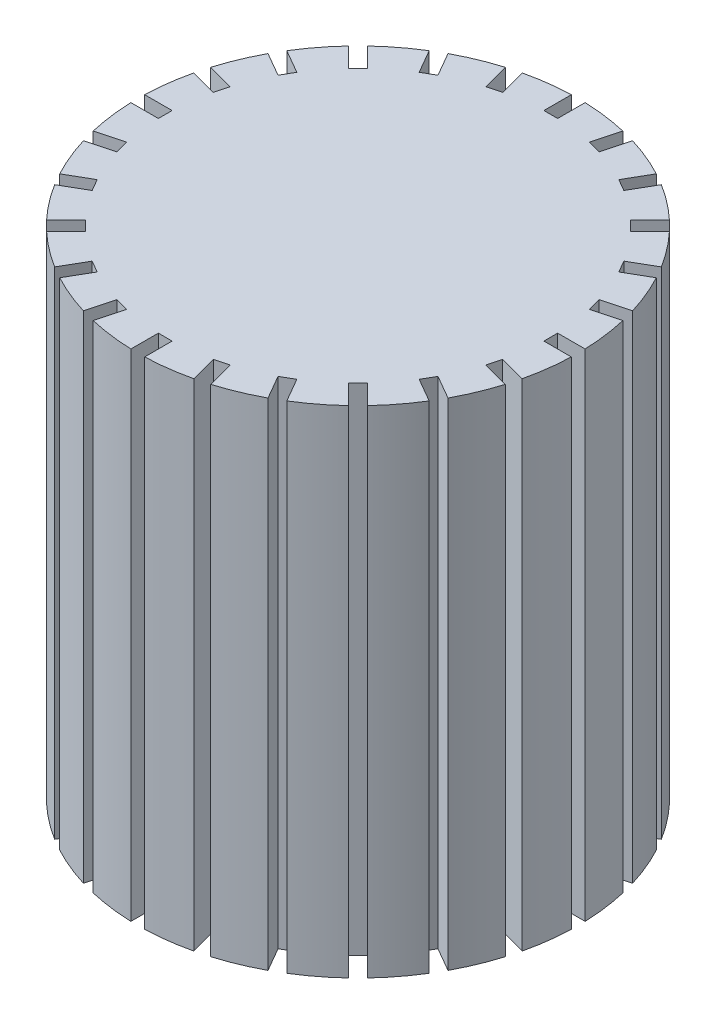
from build123d import *

# Parameters (mm, degrees)
SKETCH1_R           = 4
BOSS_EXTRUDE1_DEPTH = 5
BOSS_EXTRUDE2_START = -4
SKETCH1_3_R         = 4
SKETCH1_3_R_2       = 2.375
BOSS_EXTRUDE2_DEPTH = 4
SKETCH2_W           = 0.25
SKETCH2_H           = 0.5
CUT_EXTRUDE1_DEPTH  = 11.630145813
CIRPATTERN1_COUNT   = 24


with BuildPart() as part:
    # Sketch1 → Boss-Extrude1 (new body)
    with BuildSketch(Plane(origin=(0, 0, 0), x_dir=(1, 0, 0), z_dir=(0, 1, 0))):
        Circle(SKETCH1_R)
    extrude(amount=BOSS_EXTRUDE1_DEPTH)

    # Sketch1<3> → Boss-Extrude2 (add)
    with BuildSketch(Plane(origin=(0, 0, 0), x_dir=(1, 0, 0), z_dir=(0, 1, 0)).offset(BOSS_EXTRUDE2_START)):
        Circle(SKETCH1_3_R)
        Circle(SKETCH1_3_R_2, mode=Mode.SUBTRACT)
    extrude(amount=BOSS_EXTRUDE2_DEPTH)

    # Sketch2 → Cut-Extrude1 (cut, through all)
    with BuildSketch(Plane.XZ.offset(4)):
        with Locations((0, 3.75)):
            Rectangle(SKETCH2_W, SKETCH2_H)
    cut_extrude1 = extrude(amount=-CUT_EXTRUDE1_DEPTH, mode=Mode.SUBTRACT)

    # CirPattern1: Cut-Extrude1 ×24 about axis
    cirpattern1_axis = Axis((0, -4, 0), (0, 1, 0))
    for i in range(1, CIRPATTERN1_COUNT):
        add(cut_extrude1.rotate(cirpattern1_axis, i * 360 / CIRPATTERN1_COUNT), mode=Mode.SUBTRACT)


solid = part.part
